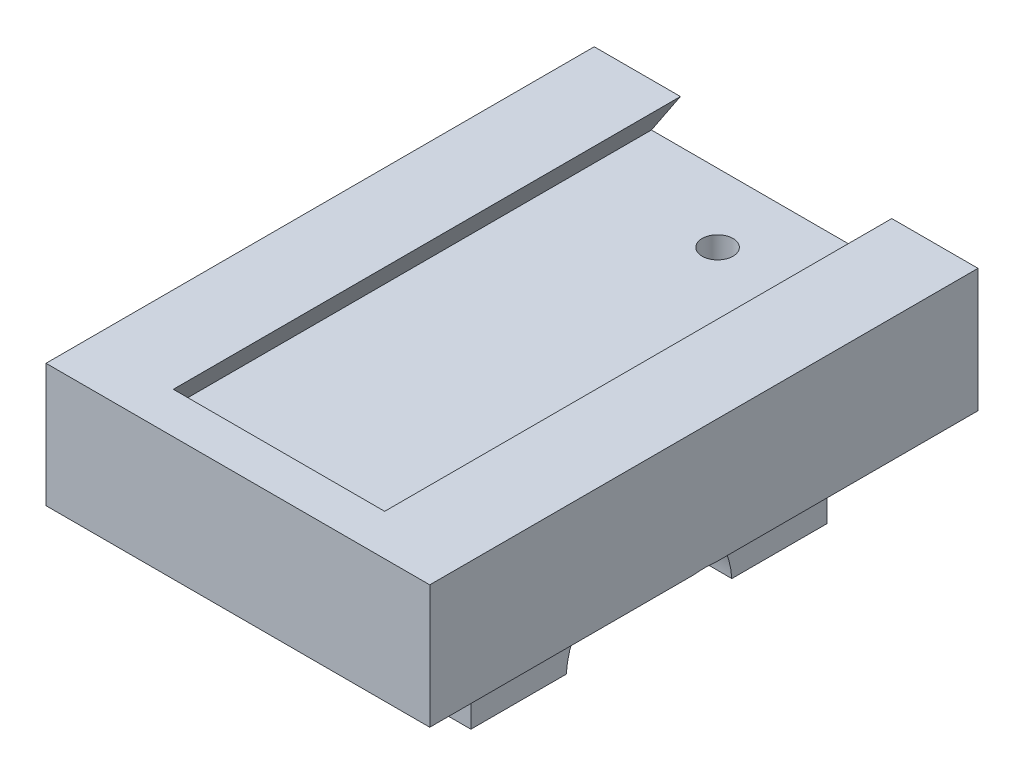
from build123d import *

# Parameters (mm, degrees)
SKETCH1_W                      = 56
SKETCH1_H                      = 18
CHANNEL_BLOCK_DEPTH            = 40
SKETCH2_W                      = 52
SKETCH2_H                      = 11.75
CLAMP_UPPER_HALF_DEPTH         = 20
DOVETAIL_CHANNEL_DEPTH         = 34
DOVETAIL_CHANNEL_DEPTH_BACK    = 41
HANDLEBAR_BORE_DEPTH           = 53.038447325
HANDLEBAR_BORE_DEPTH_BACK      = 53.038447325
SKETCH4_R                      = 12.1
SKETCH5_R                      = 3.2
M5_INSERT_HOLES_DEPTH          = 11.25
LOCK_CLEARANCE_HOLE_DEPTH      = 53.038447325
LOCK_CLEARANCE_HOLE_DEPTH_BACK = 53.038447325
SKETCH6_R                      = 2.25
SKETCH7_R                      = 2.8
LOCK_INSERT_HOLE_DEPTH         = 8


with BuildPart() as part:
    # Sketch1 → Channel Block (new, symmetric)
    with BuildSketch(Plane.XY):
        with Locations((0, 9)):
            Rectangle(SKETCH1_W, SKETCH1_H)
    extrude(amount=CHANNEL_BLOCK_DEPTH, both=True)

    # Sketch2 → Clamp Upper Half (add, symmetric)
    with BuildSketch(Plane(origin=(0, 0, 0), x_dir=(0, 0, -1), z_dir=(1, 0, 0))):
        with Locations((0, -5.375)):
            Rectangle(SKETCH2_W, SKETCH2_H)
    extrude(amount=CLAMP_UPPER_HALF_DEPTH, both=True)

    # Sketch3 → Dovetail Channel (cut, two sides: drawn at the far end of the back side and taken through both)
    with BuildSketch(Plane.XY.offset(-DOVETAIL_CHANNEL_DEPTH_BACK)):
        Polygon((-15.087314315, 18.5), (15.087314315, 18.5), (19.653980982, 11.65), (-19.653980982, 11.65), align=None)
    extrude(amount=DOVETAIL_CHANNEL_DEPTH + DOVETAIL_CHANNEL_DEPTH_BACK, mode=Mode.SUBTRACT)

    # Sketch4 → Handlebar Bore (cut, two sides: drawn at the far end of the back side and taken through both)
    with BuildSketch(Plane(origin=(0, 0, 0), x_dir=(0, 0, -1), z_dir=(1, 0, 0)).offset(-HANDLEBAR_BORE_DEPTH_BACK)):
        with Locations((0, -12)):
            Circle(SKETCH4_R)
    extrude(amount=HANDLEBAR_BORE_DEPTH + HANDLEBAR_BORE_DEPTH_BACK, mode=Mode.SUBTRACT)

    # Sketch5 → M5 Insert Holes (cut)
    with BuildSketch(Plane(origin=(0, 0, 0), x_dir=(1, 0, 0), z_dir=(0, 1, 0))):
        with Locations((0, -18.5)):
            Circle(SKETCH5_R)
        with Locations((0, 18.5)):
            Circle(SKETCH5_R)
    extrude(amount=-M5_INSERT_HOLES_DEPTH, mode=Mode.SUBTRACT)

    # Sketch6 → Lock Clearance Hole (cut, two sides: drawn at the far end of the back side and taken through both)
    with BuildSketch(Plane(origin=(0, 0, 0), x_dir=(1, 0, 0), z_dir=(0, 1, 0)).offset(-LOCK_CLEARANCE_HOLE_DEPTH_BACK)):
        with Locations((0, 30)):
            Circle(SKETCH6_R)
    extrude(amount=LOCK_CLEARANCE_HOLE_DEPTH + LOCK_CLEARANCE_HOLE_DEPTH_BACK, mode=Mode.SUBTRACT)

    # Sketch7 → Lock Insert Hole (cut)
    with BuildSketch(Plane(origin=(0, 0, 0), x_dir=(1, 0, 0), z_dir=(0, 1, 0))):
        with Locations((0, 30)):
            Circle(SKETCH7_R)
    extrude(amount=LOCK_INSERT_HOLE_DEPTH, mode=Mode.SUBTRACT)


solid = part.part
